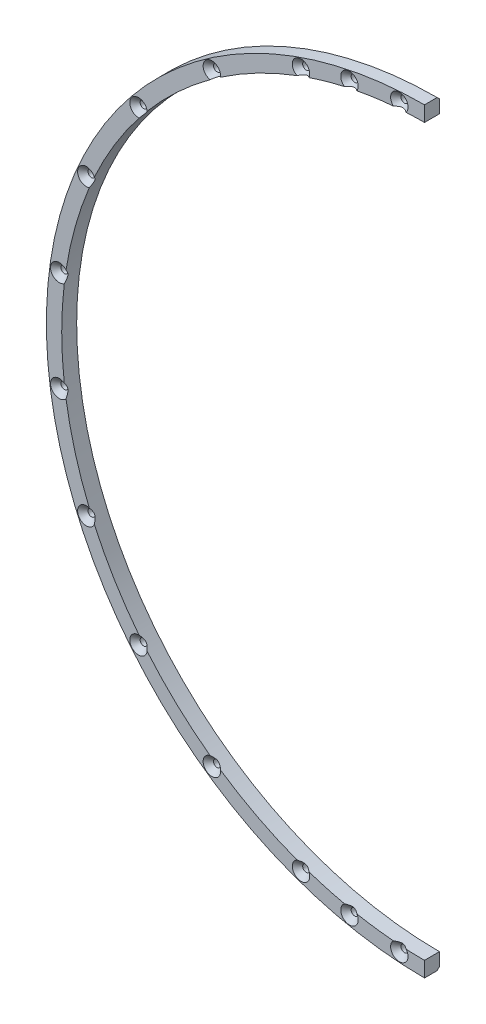
from build123d import *

# Parameters (mm, degrees)
SKETCH1_R           = 1.5
BOSS_EXTRUDE1_DEPTH = 6.35
CHAMFER2_SIZE       = 1


with BuildPart() as part:
    # Sketch1 → Boss-Extrude1 (new body)
    with BuildSketch(Plane.XY):
        with BuildLine():
            Line((0, -153.9), (0, -160.4))
            ThreePointArc((0, -160.4), (-160.4, 0), (0, 160.4))
            Line((0, 160.4), (0, 153.9))
            ThreePointArc((0, 153.9), (-153.9, 0), (0, -153.9))
        make_face()
        with Locations(Location((-10.67311345, 156.035395501, 0), (0, 0, 180))):
            Circle(SKETCH1_R, mode=Mode.SUBTRACT)
        with Locations(Location((-31.820520441, 153.128751314, 0), (0, 0, 180))):
            Circle(SKETCH1_R, mode=Mode.SUBTRACT)
        with Locations(Location((-52.375171344, 147.369608219, 0), (0, 0, 180))):
            Circle(SKETCH1_R, mode=Mode.SUBTRACT)
        with Locations(Location((-154.94328196, 21.296463919, 0), (0, 0, 180))):
            Circle(SKETCH1_R, mode=Mode.SUBTRACT)
        with Locations(Location((-143.451847555, 62.309930452, 0), (0, 0, 180))):
            Circle(SKETCH1_R, mode=Mode.SUBTRACT)
        with Locations(Location((-121.321245866, 98.702154493, 0), (0, 0, 180))):
            Circle(SKETCH1_R, mode=Mode.SUBTRACT)
        with Locations(Location((-90.192802379, 127.774091267, 0), (0, 0, 180))):
            Circle(SKETCH1_R, mode=Mode.SUBTRACT)
        with Locations(Location((-154.94328196, -21.296463919, 0), (0, 0, 180))):
            Circle(SKETCH1_R, mode=Mode.SUBTRACT)
        with Locations(Location((-143.451847555, -62.309930452, 0), (0, 0, 180))):
            Circle(SKETCH1_R, mode=Mode.SUBTRACT)
        with Locations(Location((-121.321245866, -98.702154493, 0), (0, 0, 180))):
            Circle(SKETCH1_R, mode=Mode.SUBTRACT)
        with Locations(Location((-90.192802379, -127.774091267, 0), (0, 0, 180))):
            Circle(SKETCH1_R, mode=Mode.SUBTRACT)
        with Locations(Location((-52.375171344, -147.369608219, 0), (0, 0, 180))):
            Circle(SKETCH1_R, mode=Mode.SUBTRACT)
        with Locations(Location((-10.67311345, -156.035395501, 0), (0, 0, 180))):
            Circle(SKETCH1_R, mode=Mode.SUBTRACT)
        with Locations(Location((-31.820520441, -153.128751314, 0), (0, 0, 180))):
            Circle(SKETCH1_R, mode=Mode.SUBTRACT)
    extrude(amount=BOSS_EXTRUDE1_DEPTH)

    # Chamfer1: read off the stored shape, not the designer's step
    # Chamfer1: loft between two sections, ruled curve by curve
    chamfer1_from = [
        Edge.make_three_point_arc((-9.508965266, -155.089478484, 4.15), (-11.619030468, -154.871247317, 4.15), (-11.837261635, -156.981312519, 4.15)),
        Edge.make_three_point_arc((-11.837261635, -156.981312519, 4.15), (-9.727196432, -157.199543686, 4.15), (-9.508965266, -155.089478484, 4.15)),
    ]
    chamfer1_to = [
        Edge.make_three_point_arc((-7.801547928, -153.702133524, 6.35), (-13.006375427, -153.16382998, 6.35), (-13.544678972, -158.368657479, 6.35)),
        Edge.make_three_point_arc((-13.544678972, -158.368657479, 6.35), (-8.339851473, -158.906961023, 6.35), (-7.801547928, -153.702133524, 6.35)),
    ]
    chamfer1 = Solid(Shell([*[Face.make_surface_from_curves(chamfer1_from[k], chamfer1_to[k]) for k in range(2)], Face(Wire(chamfer1_from)), Face(Wire(chamfer1_to))]))
    add(chamfer1, mode=Mode.SUBTRACT)

    # Chamfer1 2: loft between two sections, ruled curve by curve
    chamfer1_2_from = [
        Edge.make_three_point_arc((-30.538412845, -152.350162775, 4.15), (-32.59910898, -151.846643717, 4.15), (-33.102628038, -153.907339852, 4.15)),
        Edge.make_three_point_arc((-33.102628038, -153.907339852, 4.15), (-31.041931903, -154.41085891, 4.15), (-30.538412845, -152.350162775, 4.15)),
    ]
    chamfer1_2_to = [
        Edge.make_three_point_arc((-28.657988371, -151.208232919, 6.35), (-33.741038836, -149.966219243, 6.35), (-34.983052512, -155.049269708, 6.35)),
        Edge.make_three_point_arc((-34.983052512, -155.049269708, 6.35), (-29.900002047, -156.291283384, 6.35), (-28.657988371, -151.208232919, 6.35)),
    ]
    chamfer1_2 = Solid(Shell([*[Face.make_surface_from_curves(chamfer1_2_from[k], chamfer1_2_to[k]) for k in range(2)], Face(Wire(chamfer1_2_from)), Face(Wire(chamfer1_2_to))]))
    add(chamfer1_2, mode=Mode.SUBTRACT)

    # Chamfer1 3: loft between two sections, ruled curve by curve
    chamfer1_3_from = [
        Edge.make_three_point_arc((-50.998987574, -146.772851792, 4.15), (-52.971927771, -145.99342445, 4.15), (-53.751355113, -147.966364647, 4.15)),
        Edge.make_three_point_arc((-53.751355113, -147.966364647, 4.15), (-51.778414916, -148.745791988, 4.15), (-50.998987574, -146.772851792, 4.15)),
    ]
    chamfer1_3_to = [
        Edge.make_three_point_arc((-48.980584713, -145.897609032, 6.35), (-53.847170531, -143.975021589, 6.35), (-55.769757974, -148.841607407, 6.35)),
        Edge.make_three_point_arc((-55.769757974, -148.841607407, 6.35), (-50.903172156, -150.76419485, 6.35), (-48.980584713, -145.897609032, 6.35)),
    ]
    chamfer1_3 = Solid(Shell([*[Face.make_surface_from_curves(chamfer1_3_from[k], chamfer1_3_to[k]) for k in range(2)], Face(Wire(chamfer1_3_from)), Face(Wire(chamfer1_3_to))]))
    add(chamfer1_3, mode=Mode.SUBTRACT)

    # Chamfer1 4: loft between two sections, ruled curve by curve
    chamfer1_4_from = [
        Edge.make_three_point_arc((-88.70664828, -127.570754124, 4.15), (-90.396139522, -126.287937168, 4.15), (-91.678956478, -127.97742841, 4.15)),
        Edge.make_three_point_arc((-91.678956478, -127.97742841, 4.15), (-89.989465236, -129.260245366, 4.15), (-88.70664828, -127.570754124, 4.15)),
    ]
    chamfer1_4_to = [
        Edge.make_three_point_arc((-86.526955601, -127.272526314, 6.35), (-90.694367331, -124.108244489, 6.35), (-93.858649157, -128.275656219, 6.35)),
        Edge.make_three_point_arc((-93.858649157, -128.275656219, 6.35), (-89.691237426, -131.439938045, 6.35), (-86.526955601, -127.272526314, 6.35)),
    ]
    chamfer1_4 = Solid(Shell([*[Face.make_surface_from_curves(chamfer1_4_from[k], chamfer1_4_to[k]) for k in range(2)], Face(Wire(chamfer1_4_from)), Face(Wire(chamfer1_4_to))]))
    add(chamfer1_4, mode=Mode.SUBTRACT)

    # Chamfer1 5: loft between two sections, ruled curve by curve
    chamfer1_5_from = [
        Edge.make_three_point_arc((-119.835342688, -98.90731722, 4.15), (-121.116083139, -97.216251314, 4.15), (-122.807149044, -98.496991765, 4.15)),
        Edge.make_three_point_arc((-122.807149044, -98.496991765, 4.15), (-121.526408593, -100.188057671, 4.15), (-119.835342688, -98.90731722, 4.15)),
    ]
    chamfer1_5_to = [
        Edge.make_three_point_arc((-117.656018026, -99.208222553, 6.35), (-120.815177805, -95.036926653, 6.35), (-124.986473706, -98.196086432, 6.35)),
        Edge.make_three_point_arc((-124.986473706, -98.196086432, 6.35), (-121.827313927, -102.367382332, 6.35), (-117.656018026, -99.208222553, 6.35)),
    ]
    chamfer1_5 = Solid(Shell([*[Face.make_surface_from_curves(chamfer1_5_from[k], chamfer1_5_to[k]) for k in range(2)], Face(Wire(chamfer1_5_from)), Face(Wire(chamfer1_5_to))]))
    add(chamfer1_5, mode=Mode.SUBTRACT)

    # Chamfer1 6: loft between two sections, ruled curve by curve
    chamfer1_6_from = [
        Edge.make_three_point_arc((-142.076397939, -62.908377069, 4.15), (-142.853400939, -60.934480836, 4.15), (-144.827297172, -61.711483835, 4.15)),
        Edge.make_three_point_arc((-144.827297172, -61.711483835, 4.15), (-144.050294172, -63.685380068, 4.15), (-142.076397939, -62.908377069, 4.15)),
    ]
    chamfer1_6_to = [
        Edge.make_three_point_arc((-140.059071835, -63.786098773, 6.35), (-141.975679234, -58.917154732, 6.35), (-146.844623276, -60.833762131, 6.35)),
        Edge.make_three_point_arc((-146.844623276, -60.833762131, 6.35), (-144.928015876, -65.702706172, 6.35), (-140.059071835, -63.786098773, 6.35)),
    ]
    chamfer1_6 = Solid(Shell([*[Face.make_surface_from_curves(chamfer1_6_from[k], chamfer1_6_to[k]) for k in range(2)], Face(Wire(chamfer1_6_from)), Face(Wire(chamfer1_6_to))]))
    add(chamfer1_6, mode=Mode.SUBTRACT)

    # Chamfer1 7: loft between two sections, ruled curve by curve
    chamfer1_7_from = [
        Edge.make_three_point_arc((-153.780296712, -22.243810377, 4.15), (-153.995935502, -20.13347867, 4.15), (-156.106267209, -20.349117461, 4.15)),
        Edge.make_three_point_arc((-156.106267209, -20.349117461, 4.15), (-155.890628418, -22.459449167, 4.15), (-153.780296712, -22.243810377, 4.15)),
    ]
    chamfer1_7_to = [
        Edge.make_three_point_arc((-152.074585014, -23.633251849, 6.35), (-152.60649403, -18.427766972, 6.35), (-157.811978907, -18.959675989, 6.35)),
        Edge.make_three_point_arc((-157.811978907, -18.959675989, 6.35), (-157.28006989, -24.165160865, 6.35), (-152.074585014, -23.633251849, 6.35)),
    ]
    chamfer1_7 = Solid(Shell([*[Face.make_surface_from_curves(chamfer1_7_from[k], chamfer1_7_to[k]) for k in range(2)], Face(Wire(chamfer1_7_from)), Face(Wire(chamfer1_7_to))]))
    add(chamfer1_7, mode=Mode.SUBTRACT)

    # Chamfer1 8: loft between two sections, ruled curve by curve
    chamfer1_8_from = [
        Edge.make_three_point_arc((-153.780296712, 22.243810377, 4.15), (-155.890628418, 22.459449167, 4.15), (-156.106267209, 20.349117461, 4.15)),
        Edge.make_three_point_arc((-156.106267209, 20.349117461, 4.15), (-153.995935502, 20.13347867, 4.15), (-153.780296712, 22.243810377, 4.15)),
    ]
    chamfer1_8_to = [
        Edge.make_three_point_arc((-152.074585014, 23.633251849, 6.35), (-157.28006989, 24.165160865, 6.35), (-157.811978907, 18.959675989, 6.35)),
        Edge.make_three_point_arc((-157.811978907, 18.959675989, 6.35), (-152.60649403, 18.427766972, 6.35), (-152.074585014, 23.633251849, 6.35)),
    ]
    chamfer1_8 = Solid(Shell([*[Face.make_surface_from_curves(chamfer1_8_from[k], chamfer1_8_to[k]) for k in range(2)], Face(Wire(chamfer1_8_from)), Face(Wire(chamfer1_8_to))]))
    add(chamfer1_8, mode=Mode.SUBTRACT)

    # Chamfer1 9: loft between two sections, ruled curve by curve
    chamfer1_9_from = [
        Edge.make_three_point_arc((-142.076397939, 62.908377069, 4.15), (-144.050294172, 63.685380068, 4.15), (-144.827297172, 61.711483835, 4.15)),
        Edge.make_three_point_arc((-144.827297172, 61.711483835, 4.15), (-142.853400939, 60.934480836, 4.15), (-142.076397939, 62.908377069, 4.15)),
    ]
    chamfer1_9_to = [
        Edge.make_three_point_arc((-140.059071835, 63.786098773, 6.35), (-144.928015876, 65.702706172, 6.35), (-146.844623276, 60.833762131, 6.35)),
        Edge.make_three_point_arc((-146.844623276, 60.833762131, 6.35), (-141.975679234, 58.917154732, 6.35), (-140.059071835, 63.786098773, 6.35)),
    ]
    chamfer1_9 = Solid(Shell([*[Face.make_surface_from_curves(chamfer1_9_from[k], chamfer1_9_to[k]) for k in range(2)], Face(Wire(chamfer1_9_from)), Face(Wire(chamfer1_9_to))]))
    add(chamfer1_9, mode=Mode.SUBTRACT)

    # Chamfer1 10: loft between two sections, ruled curve by curve
    chamfer1_10_from = [
        Edge.make_three_point_arc((-119.835342688, 98.90731722, 4.15), (-121.526408593, 100.188057671, 4.15), (-122.807149044, 98.496991765, 4.15)),
        Edge.make_three_point_arc((-122.807149044, 98.496991765, 4.15), (-121.116083139, 97.216251314, 4.15), (-119.835342688, 98.90731722, 4.15)),
    ]
    chamfer1_10_to = [
        Edge.make_three_point_arc((-117.656018026, 99.208222553, 6.35), (-121.827313927, 102.367382332, 6.35), (-124.986473706, 98.196086432, 6.35)),
        Edge.make_three_point_arc((-124.986473706, 98.196086432, 6.35), (-120.815177805, 95.036926653, 6.35), (-117.656018026, 99.208222553, 6.35)),
    ]
    chamfer1_10 = Solid(Shell([*[Face.make_surface_from_curves(chamfer1_10_from[k], chamfer1_10_to[k]) for k in range(2)], Face(Wire(chamfer1_10_from)), Face(Wire(chamfer1_10_to))]))
    add(chamfer1_10, mode=Mode.SUBTRACT)

    # Chamfer1 11: loft between two sections, ruled curve by curve
    chamfer1_11_from = [
        Edge.make_three_point_arc((-88.70664828, 127.570754124, 4.15), (-89.989465236, 129.260245366, 4.15), (-91.678956478, 127.97742841, 4.15)),
        Edge.make_three_point_arc((-91.678956478, 127.97742841, 4.15), (-90.396139522, 126.287937168, 4.15), (-88.70664828, 127.570754124, 4.15)),
    ]
    chamfer1_11_to = [
        Edge.make_three_point_arc((-86.526955601, 127.272526314, 6.35), (-89.691237426, 131.439938045, 6.35), (-93.858649157, 128.275656219, 6.35)),
        Edge.make_three_point_arc((-93.858649157, 128.275656219, 6.35), (-90.694367331, 124.108244489, 6.35), (-86.526955601, 127.272526314, 6.35)),
    ]
    chamfer1_11 = Solid(Shell([*[Face.make_surface_from_curves(chamfer1_11_from[k], chamfer1_11_to[k]) for k in range(2)], Face(Wire(chamfer1_11_from)), Face(Wire(chamfer1_11_to))]))
    add(chamfer1_11, mode=Mode.SUBTRACT)

    # Chamfer1 12: loft between two sections, ruled curve by curve
    chamfer1_12_from = [
        Edge.make_three_point_arc((-50.998987574, 146.772851792, 4.15), (-51.778414916, 148.745791988, 4.15), (-53.751355113, 147.966364647, 4.15)),
        Edge.make_three_point_arc((-53.751355113, 147.966364647, 4.15), (-52.971927771, 145.99342445, 4.15), (-50.998987574, 146.772851792, 4.15)),
    ]
    chamfer1_12_to = [
        Edge.make_three_point_arc((-48.980584713, 145.897609032, 6.35), (-50.903172156, 150.76419485, 6.35), (-55.769757974, 148.841607407, 6.35)),
        Edge.make_three_point_arc((-55.769757974, 148.841607407, 6.35), (-53.847170531, 143.975021589, 6.35), (-48.980584713, 145.897609032, 6.35)),
    ]
    chamfer1_12 = Solid(Shell([*[Face.make_surface_from_curves(chamfer1_12_from[k], chamfer1_12_to[k]) for k in range(2)], Face(Wire(chamfer1_12_from)), Face(Wire(chamfer1_12_to))]))
    add(chamfer1_12, mode=Mode.SUBTRACT)

    # Chamfer1 13: loft between two sections, ruled curve by curve
    chamfer1_13_from = [
        Edge.make_three_point_arc((-30.538412845, 152.350162775, 4.15), (-31.041931903, 154.41085891, 4.15), (-33.102628038, 153.907339852, 4.15)),
        Edge.make_three_point_arc((-33.102628038, 153.907339852, 4.15), (-32.59910898, 151.846643717, 4.15), (-30.538412845, 152.350162775, 4.15)),
    ]
    chamfer1_13_to = [
        Edge.make_three_point_arc((-28.657988371, 151.208232919, 6.35), (-29.900002047, 156.291283384, 6.35), (-34.983052512, 155.049269708, 6.35)),
        Edge.make_three_point_arc((-34.983052512, 155.049269708, 6.35), (-33.741038836, 149.966219243, 6.35), (-28.657988371, 151.208232919, 6.35)),
    ]
    chamfer1_13 = Solid(Shell([*[Face.make_surface_from_curves(chamfer1_13_from[k], chamfer1_13_to[k]) for k in range(2)], Face(Wire(chamfer1_13_from)), Face(Wire(chamfer1_13_to))]))
    add(chamfer1_13, mode=Mode.SUBTRACT)

    # Chamfer1 14: loft between two sections, ruled curve by curve
    chamfer1_14_from = [
        Edge.make_three_point_arc((-9.508965266, 155.089478484, 4.15), (-9.727196432, 157.199543686, 4.15), (-11.837261635, 156.981312519, 4.15)),
        Edge.make_three_point_arc((-11.837261635, 156.981312519, 4.15), (-11.619030468, 154.871247317, 4.15), (-9.508965266, 155.089478484, 4.15)),
    ]
    chamfer1_14_to = [
        Edge.make_three_point_arc((-7.801547928, 153.702133524, 6.35), (-8.339851473, 158.906961023, 6.35), (-13.544678972, 158.368657479, 6.35)),
        Edge.make_three_point_arc((-13.544678972, 158.368657479, 6.35), (-13.006375427, 153.16382998, 6.35), (-7.801547928, 153.702133524, 6.35)),
    ]
    chamfer1_14 = Solid(Shell([*[Face.make_surface_from_curves(chamfer1_14_from[k], chamfer1_14_to[k]) for k in range(2)], Face(Wire(chamfer1_14_from)), Face(Wire(chamfer1_14_to))]))
    add(chamfer1_14, mode=Mode.SUBTRACT)

    # Chamfer2
    chamfer2_edges = [part.edges().sort_by_distance(p)[0] for p in [
        (-160.4, 0, 0),
    ]]
    chamfer(chamfer2_edges, length=CHAMFER2_SIZE)


solid = part.part
